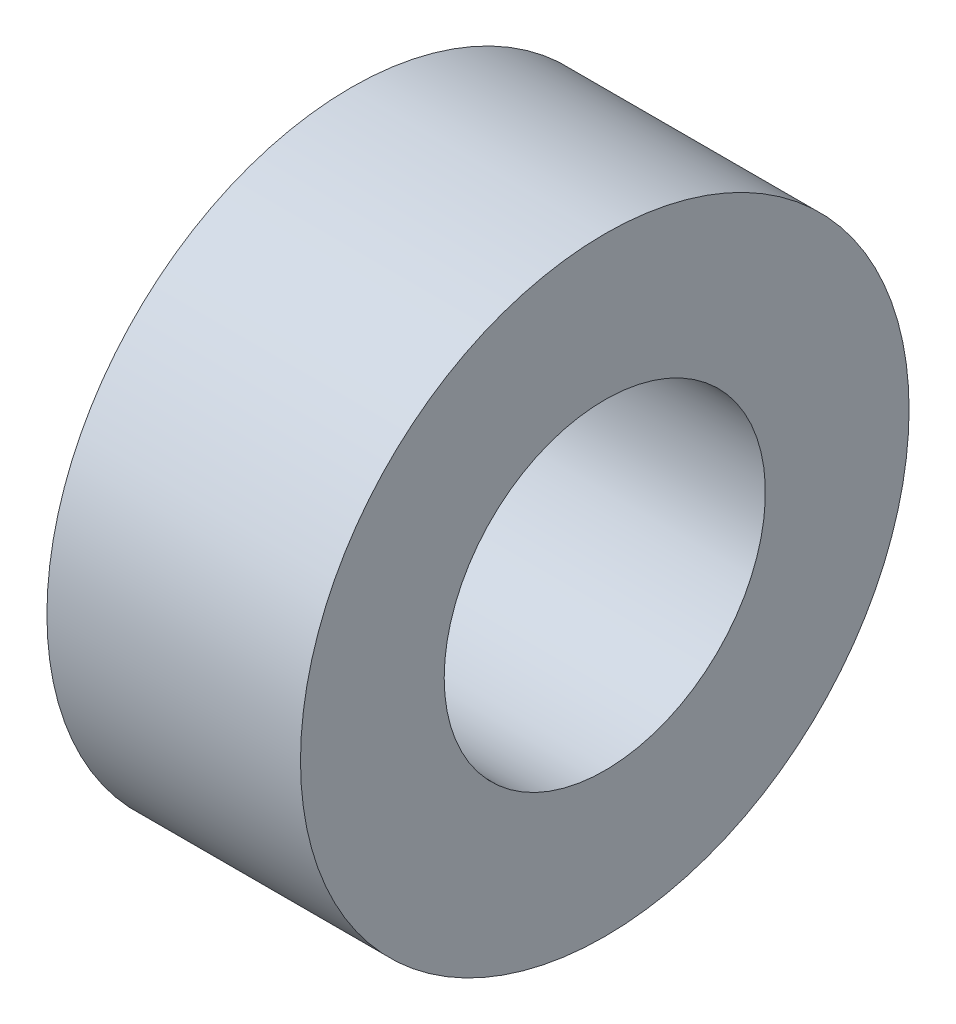
from build123d import *

# Parameters (mm, degrees)
SZKIC1_R                    = 18
SZKIC1_R_2                  = 9.5
DODANIE_WYCI_GNI_CIE1_DEPTH = 7.5


with BuildPart() as part:
    # Szkic1 → Dodanie-wyciągnięcie1 (new, symmetric)
    with BuildSketch(Plane(origin=(0, 0, 0), x_dir=(0, 0, -1), z_dir=(1, 0, 0))):
        Circle(SZKIC1_R)
        Circle(SZKIC1_R_2, mode=Mode.SUBTRACT)
    extrude(amount=DODANIE_WYCI_GNI_CIE1_DEPTH, both=True)


solid = part.part
